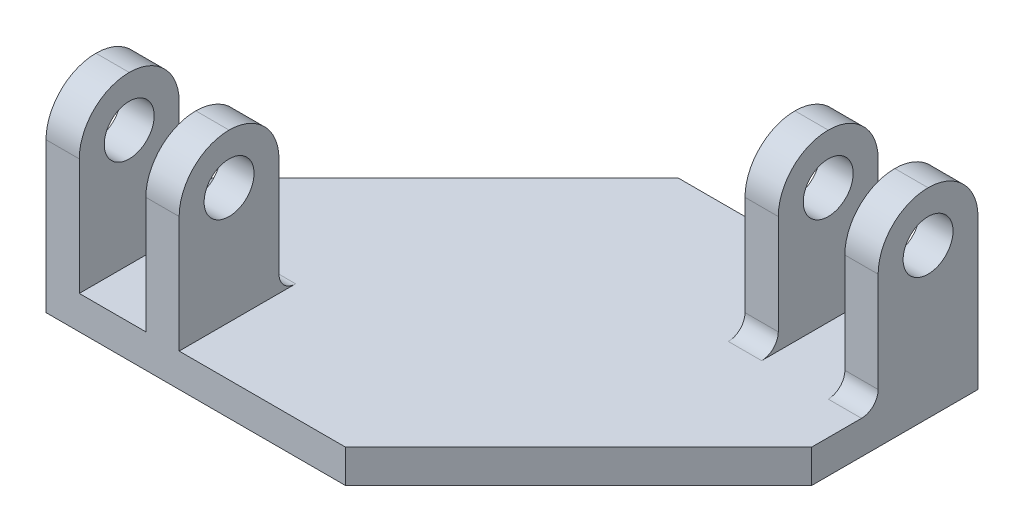
from build123d import *

# Parameters (mm, degrees)
SKETCH1_W           = 101.6
SKETCH1_H           = 76.2
BOSS_EXTRUDE1_DEPTH = 6.35
SKETCH2_W           = 6.35
SKETCH2_H           = 19.05
BOSS_EXTRUDE2_DEPTH = 31.75
SKETCH3_R           = 4.7625
CUT_EXTRUDE1_DEPTH  = 116.003391254
FILLET1_R           = 3.175
FILLET2_R           = 9.525
CHAMFER1_SIZE       = 44.45


with BuildPart() as part:
    # Sketch1 → Boss-Extrude1 (new body)
    with BuildSketch(Plane(origin=(0, 0, 0), x_dir=(1, 0, 0), z_dir=(0, 1, 0))):
        Rectangle(SKETCH1_W, SKETCH1_H)
    extrude(amount=BOSS_EXTRUDE1_DEPTH)

    # Sketch2 → Boss-Extrude2 (add)
    with BuildSketch(Plane(origin=(0, 6.35, 0), x_dir=(1, 0, 0), z_dir=(0, 1, 0))):
        with Locations((-47.625, -28.575)):
            Rectangle(SKETCH2_W, SKETCH2_H)
        with Locations((-28.575, -28.575)):
            Rectangle(SKETCH2_W, SKETCH2_H)
        with Locations((28.575, 28.575)):
            Rectangle(SKETCH2_W, SKETCH2_H)
        with Locations((47.625, 28.575)):
            Rectangle(SKETCH2_W, SKETCH2_H)
    extrude(amount=BOSS_EXTRUDE2_DEPTH)

    # Sketch3 → Cut-Extrude1 (cut, through all)
    with BuildSketch(Plane(origin=(50.8, 0, 0), x_dir=(0, 0, -1), z_dir=(1, 0, 0))):
        with Locations((28.575, 28.575)):
            Circle(SKETCH3_R)
        with Locations((-28.575, 28.575)):
            Circle(SKETCH3_R)
    extrude(amount=-CUT_EXTRUDE1_DEPTH, mode=Mode.SUBTRACT)

    # Fillet1
    fillet1_edges = [part.edges().sort_by_distance(p)[0] for p in [
        (-47.625, 6.35, 19.05),
        (-28.575, 6.35, 19.05),
        (28.575, 6.35, -19.05),
        (47.625, 6.35, -19.05),
    ]]
    fillet(fillet1_edges, radius=FILLET1_R)

    # Fillet2
    fillet2_edges = [part.edges().sort_by_distance(p)[0] for p in [
        (28.575, 38.1, -38.1),
        (47.625, 38.1, -38.1),
        (-47.625, 38.1, 19.05),
        (-47.625, 38.1, 38.1),
        (-28.575, 38.1, 19.05),
        (-28.575, 38.1, 38.1),
        (28.575, 38.1, -19.05),
        (47.625, 38.1, -19.05),
    ]]
    fillet(fillet2_edges, radius=FILLET2_R - 0.0001)  # a hair under: the kernel refuses the full size

    # Chamfer1
    chamfer1_edges = [part.edges().sort_by_distance(p)[0] for p in [
        (-50.8, 3.175, -38.1),
        (50.8, 3.175, 38.1),
    ]]
    chamfer(chamfer1_edges, length=CHAMFER1_SIZE)


solid = part.part
